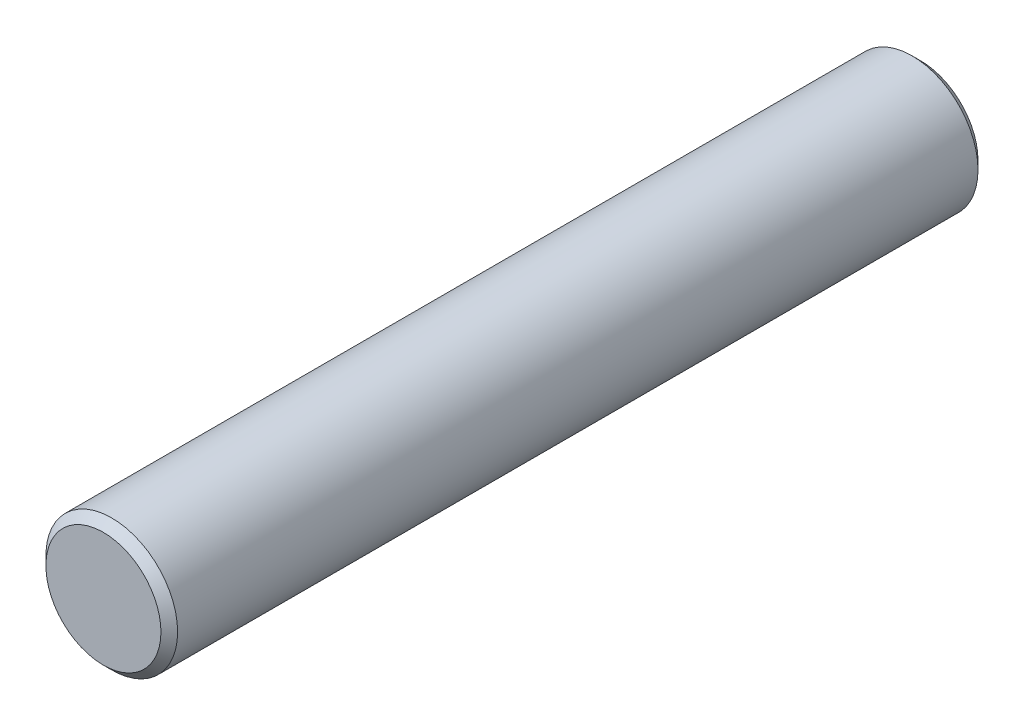
from build123d import *

# Parameters (mm, degrees)
IZIM1_R                     = 3.95
Y_KSEKLIK_EKSTR_ZYON1_DEPTH = 24.5
PAH1_SIZE                   = 0.5


with BuildPart() as part:
    # Çizim1 → Yükseklik-Ekstrüzyon1 (new, symmetric)
    with BuildSketch(Plane.XY):
        Circle(IZIM1_R)
    extrude(amount=Y_KSEKLIK_EKSTR_ZYON1_DEPTH, both=True)

    # Pah1
    pah1_edges = [part.edges().sort_by_distance(p)[0] for p in [
        (-3.95, 0, -24.5),
        (-3.95, 0, 24.5),
    ]]
    chamfer(pah1_edges, length=PAH1_SIZE)


solid = part.part
